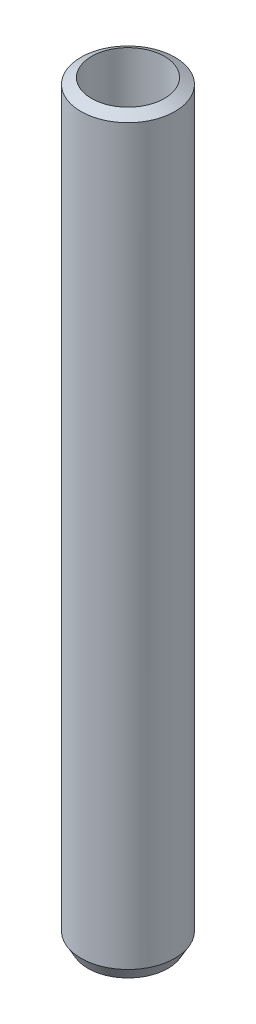
from build123d import *

# Parameters (mm, degrees)
SKETCH1_R           = 37.5
BOSS_EXTRUDE1_DEPTH = 600
SKETCH2_R           = 29.090310814
CUT_EXTRUDE1_DEPTH  = 603.339190158
CHAMFER1_SIZE       = 5.585686
CHAMFER1_SIZE_2     = 9.820543


with BuildPart() as part:
    # Sketch1 → Boss-Extrude1 (new body)
    with BuildSketch(Plane(origin=(0, 0, 0), x_dir=(1, 0, 0), z_dir=(0, 1, 0))):
        with Locations(Location((0, 0, 0), (0, 0, 270))):
            Circle(SKETCH1_R)
    extrude(amount=BOSS_EXTRUDE1_DEPTH)

    # Sketch2 → Cut-Extrude1 (cut, through all)
    with BuildSketch(Plane(origin=(0, 0, 0), x_dir=(1, 0, 0), z_dir=(0, 1, 0))):
        with Locations(Location((0, 0, 0), (0, 0, 270))):
            Circle(SKETCH2_R)
    extrude(amount=CUT_EXTRUDE1_DEPTH, mode=Mode.SUBTRACT)

    # Chamfer1
    # the kernel refuses this chamfer: 9.820543, 5.585686 mm, written as the material it takes off along each edge
    with BuildSketch(Plane(origin=(0, 600, 0), x_dir=(0, 0, 1), z_dir=(-1, 0, 0))) as chamfer1_piece_1:
        Polygon((37.5, -CHAMFER1_SIZE), (37.5 - CHAMFER1_SIZE_2, 0), (37.5, 0), align=None)
    revolve(axis=Axis((0, 600, 0), (0, 1, 0)), mode=Mode.SUBTRACT)
    with BuildSketch(Plane(origin=(0, 0, 0), x_dir=(0, 0, 1), z_dir=(-1, 0, 0))) as chamfer1_piece_2:
        Polygon((37.5, CHAMFER1_SIZE_2), (37.5 - CHAMFER1_SIZE, 0), (37.5, 0), align=None)
    revolve(axis=Axis((0, 0, 0), (0, 1, 0)), mode=Mode.SUBTRACT)


solid = part.part
